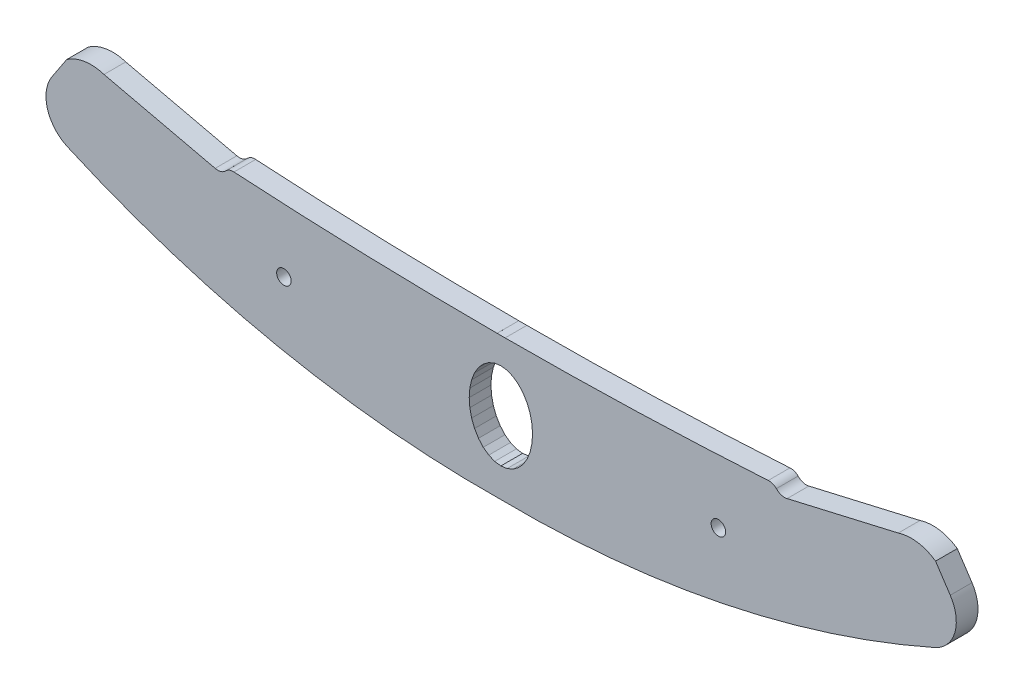
from build123d import *

# Parameters (mm, degrees)
STOCK_ACRYLIC_PARTS_1_OUTLINE_R = 1
STOCK_ACRYLIC_PARTS_1_DEPTH     = 3
SKETCH2_W                       = 1.1125911
SKETCH2_H                       = 0.19748244
CUT_EXTRUDE1_DEPTH              = 963.439452829


# Read off the part's stored shape, not the designer's step: Stock-acrylic parts-1
with BuildPart() as part:
    # Stock-acrylic parts-1 outline → Stock-acrylic parts-1 (new body)
    with BuildSketch(Plane.XY):
        with BuildLine():
            Line((832.672571413, 113.966353753), (830.641097077, 110.901419151))
            ThreePointArc((830.641097077, 110.901419151), (830.000519222, 106.767582069), (832.725500034, 103.593715565))
            ThreePointArc((832.725500034, 103.593715565), (862.032980753, 94.202742704), (892.672186774, 91.311747764))
            ThreePointArc((892.672186774, 91.311747764), (923.311281331, 94.203923771), (952.618400028, 103.596026361))
            ThreePointArc((952.618400028, 103.596026361), (955.343258494, 106.769997904), (954.702521289, 110.90381029))
            Line((954.702521289, 110.90381029), (952.670928809, 113.968666581))
            ThreePointArc((952.670928809, 113.968666581), (950.188269571, 114.970742443), (947.519688189, 114.755274729))
            Line((947.519688189, 114.755274729), (932.172066536, 111.200676976))
            ThreePointArc((932.172066536, 111.200676976), (931.366268377, 111.218620275), (930.686084525, 111.65103508))
            ThreePointArc((930.686084525, 111.65103508), (930.167968592, 111.983103753), (929.557642996, 112.061947844))
            ThreePointArc((929.557642996, 112.061947844), (892.663576086, 110.941819466), (855.769509176, 112.061947844))
            ThreePointArc((855.769509176, 112.061947844), (855.167872493, 111.978815429), (854.65750502, 111.649569718))
            ThreePointArc((854.65750502, 111.649569718), (853.977337838, 111.217128694), (853.171540371, 111.199154333))
            Line((853.171540371, 111.199154333), (837.823781708, 114.753160468))
            ThreePointArc((837.823781708, 114.753160468), (835.155192022, 114.968525315), (832.672571413, 113.966353753))
        make_face()
        with Locations((862.668334441, 102.956811364)):
            Circle(STOCK_ACRYLIC_PARTS_1_OUTLINE_R, mode=Mode.SUBTRACT)
        Polygon((891.782840588, 107.202653527), (892.63595645, 107.317748247), (893.489072311, 107.202653527), (894.309403409, 106.861792394), (895.065424878, 106.308263949), (895.728083238, 105.56333998), (896.2719129, 104.655647498), (896.676014794, 103.620068616), (896.924859512, 102.496400048), (897.00888409, 101.327823749), (896.924859512, 100.15924745), (896.676014794, 99.035578883), (896.2719129, 98), (895.728083238, 97.092307518), (895.065424878, 96.347383549), (894.309403409, 95.793855104), (893.489072311, 95.452993971), (892.63595645, 95.337899251), (891.782840588, 95.452993971), (890.962509491, 95.793855104), (890.206488022, 96.347383549), (889.543829662, 97.092307518), (889, 98), (888.595898106, 99.035578883), (888.347053388, 100.15924745), (888.263028809, 101.327823749), (888.347053388, 102.496400048), (888.595898106, 103.620068616), (889, 104.655647498), (889.543829662, 105.56333998), (890.206488022, 106.308263949), (890.962509491, 106.861792394), align=None, mode=Mode.SUBTRACT)
        with Locations((922.675390412, 102.956811364)):
            Circle(STOCK_ACRYLIC_PARTS_1_OUTLINE_R, mode=Mode.SUBTRACT)
    extrude(amount=STOCK_ACRYLIC_PARTS_1_DEPTH)

    # Sketch2 → Cut-Extrude1 (cut, through all)
    with BuildSketch(Plane.XY.offset(3)):
        with Locations((892.663576086, 111.040560686)):
            Rectangle(SKETCH2_W, SKETCH2_H)
    extrude(amount=-CUT_EXTRUDE1_DEPTH, mode=Mode.SUBTRACT)


solid = part.part
